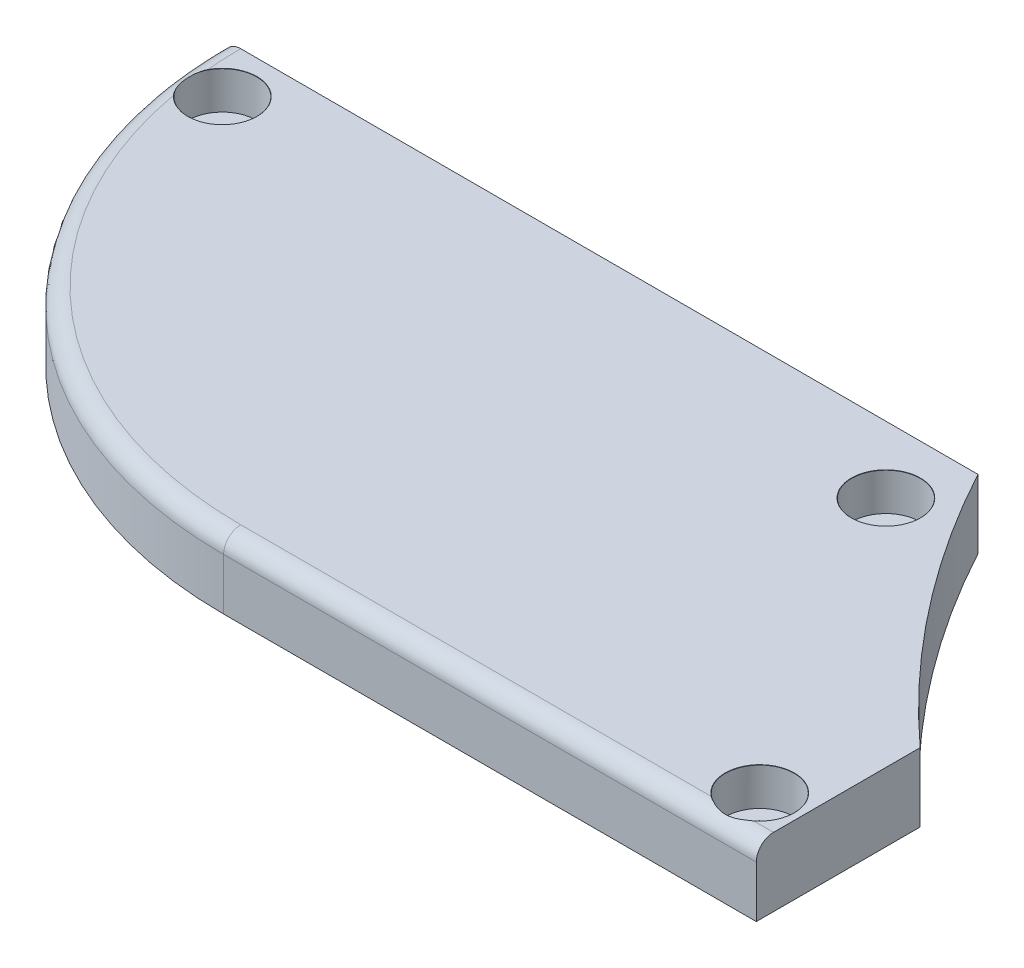
from build123d import *

# Parameters (mm, degrees)
BOSS_EXTRUDE2_DEPTH                          = 8
CBORE_FOR_M4_HEX_SOCKET_HEAD_CAP_SCR_2_COUNT = 2
CBORE_FOR_M4_HEX_SOCKET_HEAD_CAP_SCR_2_PITCH = 43.312825964
CBORE_FOR_M4_HEX_SOCKET_HEAD_CAP_SCR_3_COUNT = 2
CBORE_FOR_M4_HEX_SOCKET_HEAD_CAP_SCR_3_PITCH = 79.131181871
FILLET1_R                                    = 2


with BuildPart() as part:
    # Sketch6 → Boss-Extrude2 (new body)
    with BuildSketch(Plane(origin=(0, 0, 0), x_dir=(1, 0, 0), z_dir=(0, 1, 0))):
        with BuildLine():
            Line((-49.241489328, 24.864510752), (-56.554028145, 24.864510752))
            ThreePointArc((-56.554028145, 24.864510752), (-41.909367204, -10.490828308), (-6.554028145, -25.135489248))
            Line((-6.554028145, -25.135489248), (55.470114159, -25.135489248))
            Line((55.470114159, -25.135489248), (55.470114159, -6.057055904))
            ThreePointArc((55.470114159, -6.057055904), (42.058086193, 8.373222092), (31.280664632, 24.864510752))
            Line((31.280664632, 24.864510752), (15.257491481, 24.864510752))
            Line((15.257491481, 24.864510752), (-49.241489328, 24.864510752))
        make_face()
    extrude(amount=BOSS_EXTRUDE2_DEPTH)

    # Sketch9 → CBORE for M4 Hex Socket Head Cap Screw1 (revolve, cut)
    with BuildSketch(Plane(origin=(28.299910658, 8, -17.122913845), x_dir=(0, 0, 1), z_dir=(1, 0, 0))):
        Polygon((0, 0), (0, 11.451936393), (2.25, 10.1), (2.25, 4.4), (4, 4.4), (4, 0.025), (4.025, 0), align=None)
    cbore_for_m4_hex_socket_head_cap_screw1 = revolve(axis=Axis((28.299910658, 14.35, -17.122913845), (0, -1, 0)), mode=Mode.SUBTRACT)

    # CBORE for M4 Hex Socket Head Cap Scr 2: CBORE for M4 Hex Socket Head Cap Screw1 ×2
    with Locations(*[Vector(0.5169167622472475, 0, 0.8560356656751065) * (i * CBORE_FOR_M4_HEX_SOCKET_HEAD_CAP_SCR_2_PITCH) for i in range(1, CBORE_FOR_M4_HEX_SOCKET_HEAD_CAP_SCR_2_COUNT)]):
        add(cbore_for_m4_hex_socket_head_cap_screw1, mode=Mode.SUBTRACT)

    # CBORE for M4 Hex Socket Head Cap Scr 3: CBORE for M4 Hex Socket Head Cap Screw1 ×2
    with Locations(*[Vector(-0.9997256378089421, 0, -0.023423259967479314) * (i * CBORE_FOR_M4_HEX_SOCKET_HEAD_CAP_SCR_3_PITCH) for i in range(1, CBORE_FOR_M4_HEX_SOCKET_HEAD_CAP_SCR_3_COUNT)]):
        add(cbore_for_m4_hex_socket_head_cap_screw1, mode=Mode.SUBTRACT)

    # Fillet1
    # the kernel refuses this fillet: 2 mm, written as the material it takes off along each edge
    with BuildSketch(Plane(origin=(-6.554028145, 8, -24.864510752), x_dir=(-0.99500015408545, 0, -0.09987338669500904), z_dir=(0.09987338669500904, 0, -0.99500015408545))) as fillet1_piece_1:
        with BuildLine():
            CenterArc((50 - FILLET1_R, -FILLET1_R), FILLET1_R, 0, 90)
            Line((50, -FILLET1_R), (50, 0))
            Line((50, 0), (50 - FILLET1_R, 0))
        make_face()
    revolve(axis=Axis((-6.554028145, 8, -24.864510752), (0, 1, 0)), revolution_arc=95.731879569, mode=Mode.SUBTRACT)
    with BuildSketch(Plane(origin=(-6.554028145, 8, 25.135489248), x_dir=(0, 0, -1), z_dir=(1, 0, 0))) as fillet1_piece_2:
        with BuildLine():
            CenterArc((FILLET1_R, -FILLET1_R), FILLET1_R, 90, 90)
            Line((0, -FILLET1_R), (0, 0))
            Line((0, 0), (FILLET1_R, 0))
        make_face()
    extrude(amount=67.024142304, mode=Mode.SUBTRACT)


solid = part.part
